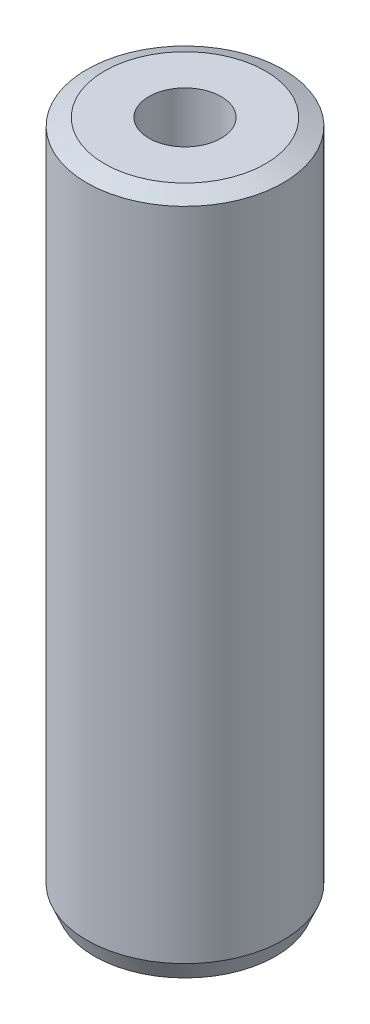
from build123d import *
from OCP.BRepFilletAPI import BRepFilletAPI_MakeChamfer

# Parameters (mm, degrees)
SKETCH1_R           = 60
BOSS_EXTRUDE1_DEPTH = 416.1127476
SKETCH2_R           = 22.084272786
CUT_EXTRUDE1_DEPTH  = 425.676133913
CHAMFER1_SIZE       = 4.642543137
CHAMFER1_SIZE2      = 10.848108672


with BuildPart() as part:
    # Sketch1 → Boss-Extrude1 (new body)
    with BuildSketch(Plane(origin=(0, 0, 0), x_dir=(1, 0, 0), z_dir=(0, 1, 0))):
        Circle(SKETCH1_R)
    extrude(amount=BOSS_EXTRUDE1_DEPTH)

    # Sketch2 → Cut-Extrude1 (cut, through all)
    with BuildSketch(Plane(origin=(0, 0, 0), x_dir=(1, 0, 0), z_dir=(0, 1, 0))):
        Circle(SKETCH2_R)
    extrude(amount=CUT_EXTRUDE1_DEPTH, mode=Mode.SUBTRACT)

    # Chamfer1: one chamfer whose edges measure the first distance from different faces: ONE call of the kernel's chamfer builder (chamfer() names one face for all edges)
    chamfer1_edges_1 = [part.edges().sort_by_distance(p)[0] for p in [
        (-60, 416.1127476, 0),
    ]]
    chamfer1_side_1 = [part.faces().sort_by_distance(p)[0] for p in [
        (-60, 208.0563738, 0),
    ]]
    chamfer1_edges_2 = [part.edges().sort_by_distance(p)[0] for p in [
        (-60, 0, 0),
    ]]
    chamfer1_side_2 = [part.faces().sort_by_distance(p)[0] for p in [
        (-58.302943725, 0, 0),
    ]]
    chamfer1 = BRepFilletAPI_MakeChamfer(part.part.solid().wrapped)
    for e in chamfer1_edges_1:
        chamfer1.Add(CHAMFER1_SIZE, CHAMFER1_SIZE2, e.wrapped, chamfer1_side_1[0].wrapped)  # the first distance lies on this face
    for e in chamfer1_edges_2:
        chamfer1.Add(CHAMFER1_SIZE, CHAMFER1_SIZE2, e.wrapped, chamfer1_side_2[0].wrapped)  # the first distance lies on this face
    add(Compound.cast(chamfer1.Shape()), mode=Mode.REPLACE)


solid = part.part
